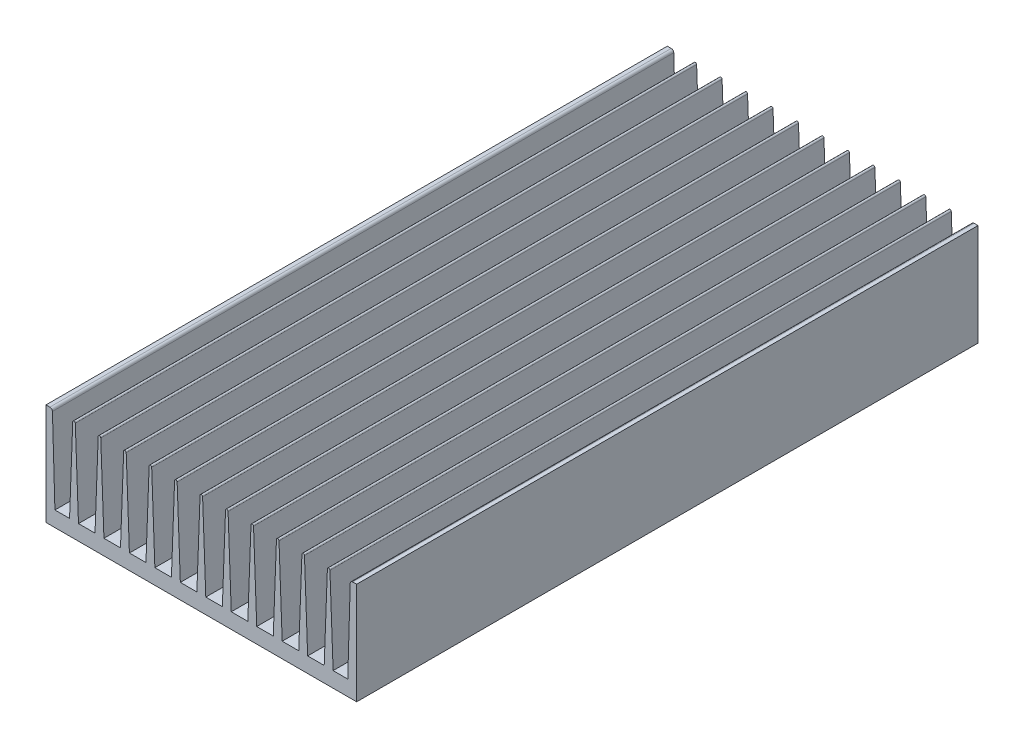
from build123d import *

# Parameters (mm, degrees)
EXTRUDE_1_DEPTH       = 244
EXTRUDE_3_DEPTH       = 244
PATTERN_CURVE_1_COUNT = 11
PATTERN_CURVE_1_PITCH = 10
SKETCH_3_R            = 2.25
CUT_EXTRUDE_1_DEPTH   = 6
SKETCH_4_R            = 2.1
SKETCH_4_R_2          = 1.6
CUT_EXTRUDE_2_DEPTH   = 6


with BuildPart() as part:
    # Эскиз1 → Вытянуть1 (new body)
    with BuildSketch(Plane.XY):
        with BuildLine():
            Line((0, 40), (1.528979332, 40))
            ThreePointArc((1.528979332, 40), (2.225614441, 39.717425624), (2.528547087, 39.029399052))
            Line((2.528547087, 39.029399052), (3.5, 6))
            Line((3.5, 6), (118.5, 6))
            Line((118.5, 6), (119.471452913, 39.029399052))
            ThreePointArc((119.471452913, 39.029399052), (119.774385559, 39.717425624), (120.471020668, 40))
            Line((120.471020668, 40), (122, 40))
            Line((122, 40), (122, 0))
            Line((122, 0), (0, 0))
            Line((0, 0), (0, 40))
        make_face()
    extrude(amount=EXTRUDE_1_DEPTH)

    # Эскиз2 → Вытянуть3 (add)
    with BuildSketch(Plane.XY.offset(244)):
        with BuildLine():
            Line((10.5, 39.5), (9.25, 6))
            Line((9.25, 6), (12.75, 6))
            Line((12.75, 6), (11.5, 39.5))
            ThreePointArc((11.5, 39.5), (11, 40), (10.5, 39.5))
        make_face()
    extrude_3 = extrude(amount=-EXTRUDE_3_DEPTH)

    # Кривая1: Вытянуть3 ×11
    with Locations(*[(i * PATTERN_CURVE_1_PITCH, 0, 0) for i in range(1, PATTERN_CURVE_1_COUNT)]):
        add(extrude_3)

    # Эскиз3 → Вырез-Вытянуть1 (cut)
    with BuildSketch(Plane.XZ):
        with Locations((26, 236)):
            Circle(SKETCH_3_R)
        with Locations((96, 236)):
            Circle(SKETCH_3_R)
        with Locations((96, 8)):
            Circle(SKETCH_3_R)
        with Locations((26, 8)):
            Circle(SKETCH_3_R)
    extrude(amount=-CUT_EXTRUDE_1_DEPTH, mode=Mode.SUBTRACT)

    # Эскиз4 → Вырез-Вытянуть2 (cut)
    with BuildSketch(Plane(origin=(1.487985642, 0, 27.400529356), x_dir=(1, 0, 0), z_dir=(0, -1, 0))):
        with Locations((65.512014358, 22.599470644)):
            Circle(SKETCH_4_R)
        with Locations((103.512014358, 109.099470644)):
            Circle(SKETCH_4_R_2)
        with Locations((60.512014358, 196.599470644)):
            Circle(SKETCH_4_R_2)
        with Locations((60.512014358, 61.599470644)):
            Circle(SKETCH_4_R_2)
    extrude(amount=-CUT_EXTRUDE_2_DEPTH, mode=Mode.SUBTRACT)


solid = part.part
